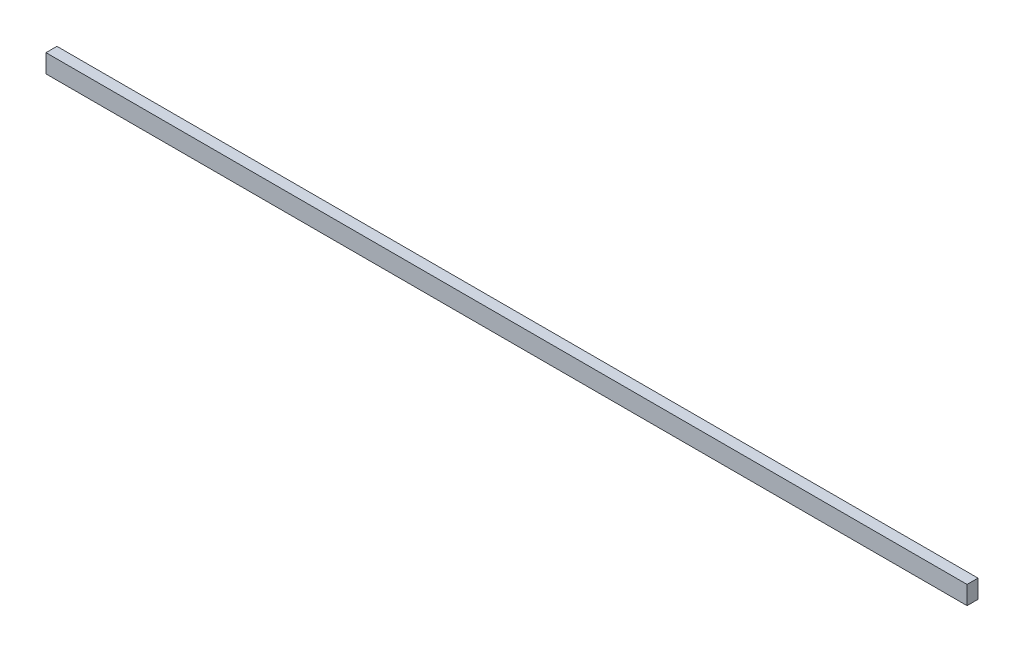
from build123d import *

# Parameters (mm, degrees)
ESQUISSE1_W        = 1850
ESQUISSE1_H        = 37
BOSS_EXTRU_1_DEPTH = 22


with BuildPart() as part:
    # Esquisse1 → Boss.-Extru.1 (new body)
    with BuildSketch(Plane.XY):
        with Locations((925, 18.5)):
            Rectangle(ESQUISSE1_W, ESQUISSE1_H)
    extrude(amount=BOSS_EXTRU_1_DEPTH)


solid = part.part
